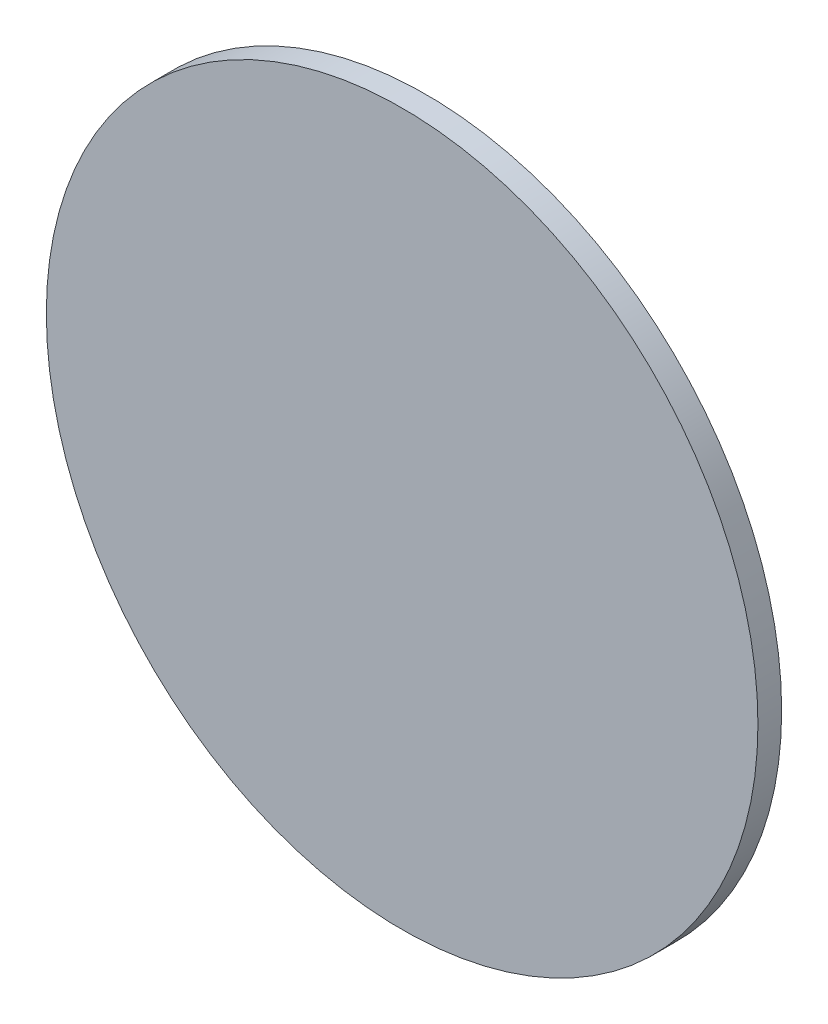
from build123d import *

# Parameters (mm, degrees)
SKETCH2_R           = 30
BOSS_EXTRUDE1_DEPTH = 2


with BuildPart() as part:
    # Sketch2 → Boss-Extrude1 (new body)
    with BuildSketch(Plane.XY):
        Circle(SKETCH2_R)
    extrude(amount=BOSS_EXTRUDE1_DEPTH)


solid = part.part
